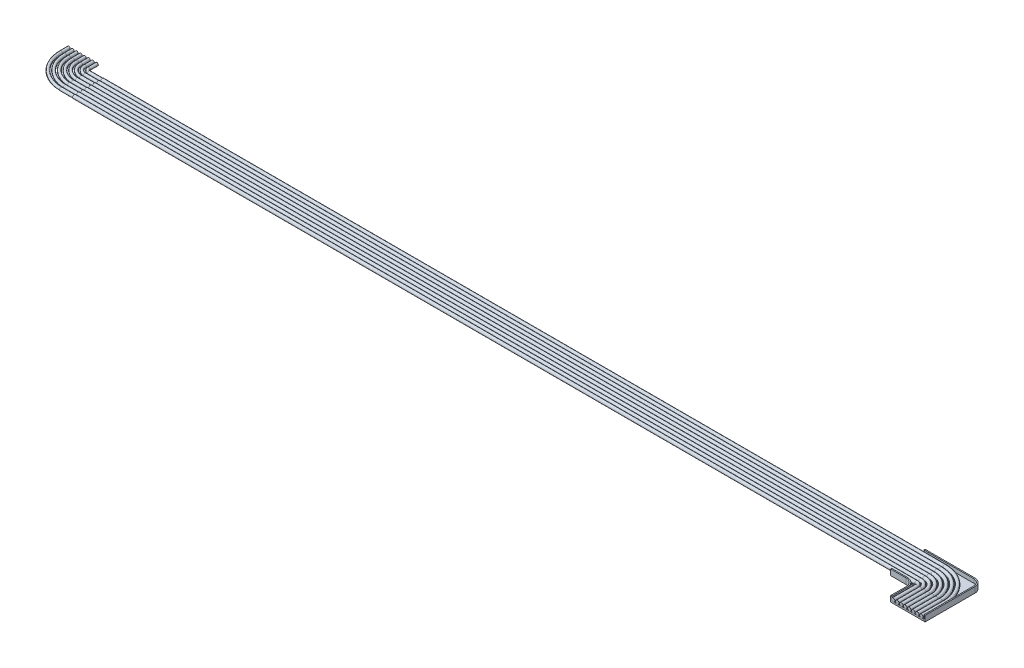
from build123d import *

# Parameters (mm, degrees)
SALIENTE_EXTRUIR1_DEPTH   = 100
CORTAR_EXTRUIR1_DEPTH     = 70
CROQUIS3_W                = 60.540405411
CROQUIS3_H                = 560
CORTAR_EXTRUIR2_DEPTH     = 70
MATRIZL1_COUNT            = 3
MATRIZL1_PITCH            = 130
CROQUIS4_W                = 560
CROQUIS4_H                = 60
CORTAR_EXTRUIR3_DEPTH     = 70
MATRIZL2_COUNT            = 3
MATRIZL2_PITCH            = 140
CROQUIS7_R                = 9.728943594
CORTAR_EXTRUIR6_DEPTH     = 70
MATRIZL3_COUNT            = 13
MATRIZL3_PITCH            = 40
MATRIZL4_COPY_1_SKETCH_R  = 9.728943594
MATRIZL4_COPY_1_DEPTH     = 70
MATRIZL4_COPY_2_SKETCH_R  = 9.728943594
MATRIZL4_COPY_2_DEPTH     = 70
MATRIZL4_COPY_3_SKETCH_R  = 9.728943594
MATRIZL4_COPY_3_DEPTH     = 70
MATRIZL4_COPY_4_SKETCH_R  = 9.728943594
MATRIZL4_COPY_4_DEPTH     = 70
MATRIZL4_COPY_5_SKETCH_R  = 9.728943594
MATRIZL4_COPY_5_DEPTH     = 70
MATRIZL4_COPY_6_SKETCH_R  = 9.728943594
MATRIZL4_COPY_6_DEPTH     = 70
MATRIZL4_COPY_7_SKETCH_R  = 9.728943594
MATRIZL4_COPY_7_DEPTH     = 70
MATRIZL4_COPY_8_SKETCH_R  = 9.728943594
MATRIZL4_COPY_8_DEPTH     = 70
MATRIZL4_COPY_9_SKETCH_R  = 9.728943594
MATRIZL4_COPY_9_DEPTH     = 70
MATRIZL4_COPY_10_SKETCH_R = 9.728943594
MATRIZL4_COPY_10_DEPTH    = 70
MATRIZL4_COPY_11_SKETCH_R = 9.728943594
MATRIZL4_COPY_11_DEPTH    = 70
MATRIZL4_COPY_12_SKETCH_R = 9.728943594
MATRIZL4_COPY_12_DEPTH    = 70
MATRIZL4_COPY_13_SKETCH_R = 9.728943594
MATRIZL4_COPY_13_DEPTH    = 70
MATRIZL4_COPY_14_SKETCH_R = 9.728943594
MATRIZL4_COPY_14_DEPTH    = 70
MATRIZL4_COPY_15_SKETCH_R = 9.728943594
MATRIZL4_COPY_15_DEPTH    = 70
MATRIZL4_COPY_16_SKETCH_R = 9.728943594
MATRIZL4_COPY_16_DEPTH    = 70
MATRIZL4_COPY_17_SKETCH_R = 9.728943594
MATRIZL4_COPY_17_DEPTH    = 70
MATRIZL4_COPY_18_SKETCH_R = 9.728943594
MATRIZL4_COPY_18_DEPTH    = 70
MATRIZL4_COPY_19_SKETCH_R = 9.728943594
MATRIZL4_COPY_19_DEPTH    = 70
MATRIZL4_COPY_20_SKETCH_R = 9.728943594
MATRIZL4_COPY_20_DEPTH    = 70
MATRIZL4_COPY_21_SKETCH_R = 9.728943594
MATRIZL4_COPY_21_DEPTH    = 70
MATRIZL4_COPY_22_SKETCH_R = 9.728943594
MATRIZL4_COPY_22_DEPTH    = 70
MATRIZL4_COPY_23_SKETCH_R = 9.728943594
MATRIZL4_COPY_23_DEPTH    = 70
MATRIZL4_COPY_24_SKETCH_R = 9.728943594
MATRIZL4_COPY_24_DEPTH    = 70
MATRIZL4_COPY_25_SKETCH_R = 9.728943594
MATRIZL4_COPY_25_DEPTH    = 70
MATRIZL4_COPY_26_SKETCH_R = 9.728943594
MATRIZL4_COPY_26_DEPTH    = 70
CROQUIS8_R                = 10.865293649
CORTAR_EXTRUIR7_DEPTH     = 70
MATRIZL5_COUNT            = 16
MATRIZL5_PITCH            = 30
MATRIZL6_COPY_1_SKETCH_R  = 10.865293649
MATRIZL6_COPY_1_DEPTH     = 70
MATRIZL6_COPY_2_SKETCH_R  = 10.865293649
MATRIZL6_COPY_2_DEPTH     = 70
MATRIZL6_COPY_3_SKETCH_R  = 10.865293649
MATRIZL6_COPY_3_DEPTH     = 70
MATRIZL6_COPY_4_SKETCH_R  = 10.865293649
MATRIZL6_COPY_4_DEPTH     = 70
MATRIZL6_COPY_5_SKETCH_R  = 10.865293649
MATRIZL6_COPY_5_DEPTH     = 70
MATRIZL6_COPY_6_SKETCH_R  = 10.865293649
MATRIZL6_COPY_6_DEPTH     = 70
MATRIZL6_COPY_7_SKETCH_R  = 10.865293649
MATRIZL6_COPY_7_DEPTH     = 70
MATRIZL6_COPY_8_SKETCH_R  = 10.865293649
MATRIZL6_COPY_8_DEPTH     = 70
MATRIZL6_COPY_9_SKETCH_R  = 10.865293649
MATRIZL6_COPY_9_DEPTH     = 70
MATRIZL6_COPY_10_SKETCH_R = 10.865293649
MATRIZL6_COPY_10_DEPTH    = 70
MATRIZL6_COPY_11_SKETCH_R = 10.865293649
MATRIZL6_COPY_11_DEPTH    = 70
MATRIZL6_COPY_12_SKETCH_R = 10.865293649
MATRIZL6_COPY_12_DEPTH    = 70
MATRIZL6_COPY_13_SKETCH_R = 10.865293649
MATRIZL6_COPY_13_DEPTH    = 70
MATRIZL6_COPY_14_SKETCH_R = 10.865293649
MATRIZL6_COPY_14_DEPTH    = 70
MATRIZL6_COPY_15_SKETCH_R = 10.865293649
MATRIZL6_COPY_15_DEPTH    = 70
MATRIZL6_COPY_16_SKETCH_R = 10.865293649
MATRIZL6_COPY_16_DEPTH    = 70
MATRIZL6_COPY_17_SKETCH_R = 10.865293649
MATRIZL6_COPY_17_DEPTH    = 70
MATRIZL6_COPY_18_SKETCH_R = 10.865293649
MATRIZL6_COPY_18_DEPTH    = 70
MATRIZL6_COPY_19_SKETCH_R = 10.865293649
MATRIZL6_COPY_19_DEPTH    = 70
MATRIZL6_COPY_20_SKETCH_R = 10.865293649
MATRIZL6_COPY_20_DEPTH    = 70
MATRIZL6_COPY_21_SKETCH_R = 10.865293649
MATRIZL6_COPY_21_DEPTH    = 70
MATRIZL6_COPY_22_SKETCH_R = 10.865293649
MATRIZL6_COPY_22_DEPTH    = 70
MATRIZL6_COPY_23_SKETCH_R = 10.865293649
MATRIZL6_COPY_23_DEPTH    = 70
MATRIZL6_COPY_24_SKETCH_R = 10.865293649
MATRIZL6_COPY_24_DEPTH    = 70
MATRIZL6_COPY_25_SKETCH_R = 10.865293649
MATRIZL6_COPY_25_DEPTH    = 70
MATRIZL6_COPY_26_SKETCH_R = 10.865293649
MATRIZL6_COPY_26_DEPTH    = 70
MATRIZL6_COPY_27_SKETCH_R = 10.865293649
MATRIZL6_COPY_27_DEPTH    = 70
MATRIZL6_COPY_28_SKETCH_R = 10.865293649
MATRIZL6_COPY_28_DEPTH    = 70
MATRIZL6_COPY_29_SKETCH_R = 10.865293649
MATRIZL6_COPY_29_DEPTH    = 70
MATRIZL6_COPY_30_SKETCH_R = 10.865293649
MATRIZL6_COPY_30_DEPTH    = 70
MATRIZL6_COPY_31_SKETCH_R = 10.865293649
MATRIZL6_COPY_31_DEPTH    = 70
MATRIZL6_COPY_32_SKETCH_R = 10.865293649
MATRIZL6_COPY_32_DEPTH    = 70
MATRIZL6_COPY_33_SKETCH_R = 10.865293649
MATRIZL6_COPY_33_DEPTH    = 70
MATRIZL6_COPY_34_SKETCH_R = 10.865293649
MATRIZL6_COPY_34_DEPTH    = 70
MATRIZL6_COPY_35_SKETCH_R = 10.865293649
MATRIZL6_COPY_35_DEPTH    = 70
MATRIZL6_COPY_36_SKETCH_R = 10.865293649
MATRIZL6_COPY_36_DEPTH    = 70
MATRIZL6_COPY_37_SKETCH_R = 10.865293649
MATRIZL6_COPY_37_DEPTH    = 70
MATRIZL6_COPY_38_SKETCH_R = 10.865293649
MATRIZL6_COPY_38_DEPTH    = 70
MATRIZL6_COPY_39_SKETCH_R = 10.865293649
MATRIZL6_COPY_39_DEPTH    = 70
MATRIZL6_COPY_40_SKETCH_R = 10.865293649
MATRIZL6_COPY_40_DEPTH    = 70
MATRIZL6_COPY_41_SKETCH_R = 10.865293649
MATRIZL6_COPY_41_DEPTH    = 70
MATRIZL6_COPY_42_SKETCH_R = 10.865293649
MATRIZL6_COPY_42_DEPTH    = 70
MATRIZL6_COPY_43_SKETCH_R = 10.865293649
MATRIZL6_COPY_43_DEPTH    = 70
MATRIZL6_COPY_44_SKETCH_R = 10.865293649
MATRIZL6_COPY_44_DEPTH    = 70
MATRIZL6_COPY_45_SKETCH_R = 10.865293649
MATRIZL6_COPY_45_DEPTH    = 70
MATRIZL6_COPY_46_SKETCH_R = 10.865293649
MATRIZL6_COPY_46_DEPTH    = 70
MATRIZL6_COPY_47_SKETCH_R = 10.865293649
MATRIZL6_COPY_47_DEPTH    = 70
MATRIZL6_COPY_48_SKETCH_R = 10.865293649
MATRIZL6_COPY_48_DEPTH    = 70
CROQUIS9_W                = 560
CROQUIS9_H                = 73.445745209
CORTAR_EXTRUIR8_DEPTH     = 70
CROQUIS10_R               = 30
CROQUIS11_R               = 30
SALIENTE_EXTRUIR2_DEPTH   = 14300
CROQUIS12_R               = 25
CROQUIS14_R               = 26.306905199
SALIENTE_EXTRUIR3_DEPTH   = 232


with BuildPart() as part:
    # Croquis1 → Saliente-Extruir1 (new body)
    with BuildSketch(Plane(origin=(0, 0, 0), x_dir=(1, 0, 0), z_dir=(0, 1, 0))):
        with BuildLine():
            Line((0, 0), (0, 270))
            ThreePointArc((0, 270), (-38.076118446, 361.923881554), (-130, 400))
            Line((-130, 400), (-400, 400))
            Line((-400, 400), (-400, 1000))
            Line((-400, 1000), (470, 1000))
            ThreePointArc((470, 1000), (561.923881554, 961.923881554), (600, 870))
            Line((600, 870), (600, 0))
            Line((600, 0), (0, 0))
        make_face()
    extrude(amount=SALIENTE_EXTRUIR1_DEPTH)

    # Croquis2 → Cortar-Extruir1 (cut)
    with BuildSketch(Plane(origin=(0, 100, 0), x_dir=(1, 0, 0), z_dir=(0, 1, 0))):
        with BuildLine():
            Line((20, 0), (580, 0))
            Line((580, 0), (580, 870))
            ThreePointArc((580, 870), (547.781745931, 947.781745931), (470, 980))
            Line((470, 980), (-400, 980))
            Line((-400, 980), (-400, 420))
            Line((-400, 420), (-130, 420))
            ThreePointArc((-130, 420), (-23.933982822, 376.066017178), (20, 270))
            Line((20, 270), (20, 0))
        make_face()
    extrude(amount=-CORTAR_EXTRUIR1_DEPTH, mode=Mode.SUBTRACT)

    # Croquis3 → Cortar-Extruir2 (cut)
    with BuildSketch(Plane(origin=(0, 30, 0), x_dir=(1, 0, 0), z_dir=(0, 1, 0))):
        with Locations((-295.270202705, 700)):
            Rectangle(CROQUIS3_W, CROQUIS3_H)
    cortar_extruir2 = extrude(amount=-CORTAR_EXTRUIR2_DEPTH, mode=Mode.SUBTRACT)

    # MatrizL1: Cortar-Extruir2 ×3
    with Locations(*[(i * MATRIZL1_PITCH, 0, 0) for i in range(1, MATRIZL1_COUNT)]):
        add(cortar_extruir2, mode=Mode.SUBTRACT)

    # Croquis4 → Cortar-Extruir3 (cut)
    with BuildSketch(Plane(origin=(0, 30, 0), x_dir=(1, 0, 0), z_dir=(0, 1, 0))):
        with Locations((300, 104)):
            Rectangle(CROQUIS4_W, CROQUIS4_H)
    cortar_extruir3 = extrude(amount=-CORTAR_EXTRUIR3_DEPTH, mode=Mode.SUBTRACT)

    # MatrizL2: Cortar-Extruir3 ×3
    with Locations(*[(0, 0, -i * MATRIZL2_PITCH) for i in range(1, MATRIZL2_COUNT)]):
        add(cortar_extruir3, mode=Mode.SUBTRACT)

    # Croquis7 → Cortar-Extruir6 (cut)
    with BuildSketch(Plane(origin=(0, 30, 0), x_dir=(1, 0, 0), z_dir=(0, 1, 0))):
        with Locations((-361.435433024, 925.957073649)):
            Circle(CROQUIS7_R)
    cortar_extruir6 = extrude(amount=-CORTAR_EXTRUIR6_DEPTH, mode=Mode.SUBTRACT)

    # MatrizL3: Cortar-Extruir6 ×13
    with Locations(*[(0, 0, i * MATRIZL3_PITCH) for i in range(1, MATRIZL3_COUNT)]):
        add(cortar_extruir6, mode=Mode.SUBTRACT)

    # MatrizL4 copy 1 sketch → MatrizL4 copy 1 (cut)
    with BuildSketch(Plane(origin=(130, 30, 40), x_dir=(1, 0, 0), z_dir=(0, 1, 0))):
        with Locations((-361.435433024, 925.957073649)):
            Circle(MATRIZL4_COPY_1_SKETCH_R)
    extrude(amount=-MATRIZL4_COPY_1_DEPTH, mode=Mode.SUBTRACT)

    # MatrizL4 copy 2 sketch → MatrizL4 copy 2 (cut)
    with BuildSketch(Plane(origin=(260, 30, 40), x_dir=(1, 0, 0), z_dir=(0, 1, 0))):
        with Locations((-361.435433024, 925.957073649)):
            Circle(MATRIZL4_COPY_2_SKETCH_R)
    extrude(amount=-MATRIZL4_COPY_2_DEPTH, mode=Mode.SUBTRACT)

    # MatrizL4 copy 3 sketch → MatrizL4 copy 3 (cut)
    with BuildSketch(Plane(origin=(130, 30, 80), x_dir=(1, 0, 0), z_dir=(0, 1, 0))):
        with Locations((-361.435433024, 925.957073649)):
            Circle(MATRIZL4_COPY_3_SKETCH_R)
    extrude(amount=-MATRIZL4_COPY_3_DEPTH, mode=Mode.SUBTRACT)

    # MatrizL4 copy 4 sketch → MatrizL4 copy 4 (cut)
    with BuildSketch(Plane(origin=(260, 30, 80), x_dir=(1, 0, 0), z_dir=(0, 1, 0))):
        with Locations((-361.435433024, 925.957073649)):
            Circle(MATRIZL4_COPY_4_SKETCH_R)
    extrude(amount=-MATRIZL4_COPY_4_DEPTH, mode=Mode.SUBTRACT)

    # MatrizL4 copy 5 sketch → MatrizL4 copy 5 (cut)
    with BuildSketch(Plane(origin=(130, 30, 120), x_dir=(1, 0, 0), z_dir=(0, 1, 0))):
        with Locations((-361.435433024, 925.957073649)):
            Circle(MATRIZL4_COPY_5_SKETCH_R)
    extrude(amount=-MATRIZL4_COPY_5_DEPTH, mode=Mode.SUBTRACT)

    # MatrizL4 copy 6 sketch → MatrizL4 copy 6 (cut)
    with BuildSketch(Plane(origin=(260, 30, 120), x_dir=(1, 0, 0), z_dir=(0, 1, 0))):
        with Locations((-361.435433024, 925.957073649)):
            Circle(MATRIZL4_COPY_6_SKETCH_R)
    extrude(amount=-MATRIZL4_COPY_6_DEPTH, mode=Mode.SUBTRACT)

    # MatrizL4 copy 7 sketch → MatrizL4 copy 7 (cut)
    with BuildSketch(Plane(origin=(130, 30, 160), x_dir=(1, 0, 0), z_dir=(0, 1, 0))):
        with Locations((-361.435433024, 925.957073649)):
            Circle(MATRIZL4_COPY_7_SKETCH_R)
    extrude(amount=-MATRIZL4_COPY_7_DEPTH, mode=Mode.SUBTRACT)

    # MatrizL4 copy 8 sketch → MatrizL4 copy 8 (cut)
    with BuildSketch(Plane(origin=(260, 30, 160), x_dir=(1, 0, 0), z_dir=(0, 1, 0))):
        with Locations((-361.435433024, 925.957073649)):
            Circle(MATRIZL4_COPY_8_SKETCH_R)
    extrude(amount=-MATRIZL4_COPY_8_DEPTH, mode=Mode.SUBTRACT)

    # MatrizL4 copy 9 sketch → MatrizL4 copy 9 (cut)
    with BuildSketch(Plane(origin=(130, 30, 200), x_dir=(1, 0, 0), z_dir=(0, 1, 0))):
        with Locations((-361.435433024, 925.957073649)):
            Circle(MATRIZL4_COPY_9_SKETCH_R)
    extrude(amount=-MATRIZL4_COPY_9_DEPTH, mode=Mode.SUBTRACT)

    # MatrizL4 copy 10 sketch → MatrizL4 copy 10 (cut)
    with BuildSketch(Plane(origin=(260, 30, 200), x_dir=(1, 0, 0), z_dir=(0, 1, 0))):
        with Locations((-361.435433024, 925.957073649)):
            Circle(MATRIZL4_COPY_10_SKETCH_R)
    extrude(amount=-MATRIZL4_COPY_10_DEPTH, mode=Mode.SUBTRACT)

    # MatrizL4 copy 11 sketch → MatrizL4 copy 11 (cut)
    with BuildSketch(Plane(origin=(130, 30, 240), x_dir=(1, 0, 0), z_dir=(0, 1, 0))):
        with Locations((-361.435433024, 925.957073649)):
            Circle(MATRIZL4_COPY_11_SKETCH_R)
    extrude(amount=-MATRIZL4_COPY_11_DEPTH, mode=Mode.SUBTRACT)

    # MatrizL4 copy 12 sketch → MatrizL4 copy 12 (cut)
    with BuildSketch(Plane(origin=(260, 30, 240), x_dir=(1, 0, 0), z_dir=(0, 1, 0))):
        with Locations((-361.435433024, 925.957073649)):
            Circle(MATRIZL4_COPY_12_SKETCH_R)
    extrude(amount=-MATRIZL4_COPY_12_DEPTH, mode=Mode.SUBTRACT)

    # MatrizL4 copy 13 sketch → MatrizL4 copy 13 (cut)
    with BuildSketch(Plane(origin=(130, 30, 280), x_dir=(1, 0, 0), z_dir=(0, 1, 0))):
        with Locations((-361.435433024, 925.957073649)):
            Circle(MATRIZL4_COPY_13_SKETCH_R)
    extrude(amount=-MATRIZL4_COPY_13_DEPTH, mode=Mode.SUBTRACT)

    # MatrizL4 copy 14 sketch → MatrizL4 copy 14 (cut)
    with BuildSketch(Plane(origin=(260, 30, 280), x_dir=(1, 0, 0), z_dir=(0, 1, 0))):
        with Locations((-361.435433024, 925.957073649)):
            Circle(MATRIZL4_COPY_14_SKETCH_R)
    extrude(amount=-MATRIZL4_COPY_14_DEPTH, mode=Mode.SUBTRACT)

    # MatrizL4 copy 15 sketch → MatrizL4 copy 15 (cut)
    with BuildSketch(Plane(origin=(130, 30, 320), x_dir=(1, 0, 0), z_dir=(0, 1, 0))):
        with Locations((-361.435433024, 925.957073649)):
            Circle(MATRIZL4_COPY_15_SKETCH_R)
    extrude(amount=-MATRIZL4_COPY_15_DEPTH, mode=Mode.SUBTRACT)

    # MatrizL4 copy 16 sketch → MatrizL4 copy 16 (cut)
    with BuildSketch(Plane(origin=(260, 30, 320), x_dir=(1, 0, 0), z_dir=(0, 1, 0))):
        with Locations((-361.435433024, 925.957073649)):
            Circle(MATRIZL4_COPY_16_SKETCH_R)
    extrude(amount=-MATRIZL4_COPY_16_DEPTH, mode=Mode.SUBTRACT)

    # MatrizL4 copy 17 sketch → MatrizL4 copy 17 (cut)
    with BuildSketch(Plane(origin=(130, 30, 360), x_dir=(1, 0, 0), z_dir=(0, 1, 0))):
        with Locations((-361.435433024, 925.957073649)):
            Circle(MATRIZL4_COPY_17_SKETCH_R)
    extrude(amount=-MATRIZL4_COPY_17_DEPTH, mode=Mode.SUBTRACT)

    # MatrizL4 copy 18 sketch → MatrizL4 copy 18 (cut)
    with BuildSketch(Plane(origin=(260, 30, 360), x_dir=(1, 0, 0), z_dir=(0, 1, 0))):
        with Locations((-361.435433024, 925.957073649)):
            Circle(MATRIZL4_COPY_18_SKETCH_R)
    extrude(amount=-MATRIZL4_COPY_18_DEPTH, mode=Mode.SUBTRACT)

    # MatrizL4 copy 19 sketch → MatrizL4 copy 19 (cut)
    with BuildSketch(Plane(origin=(130, 30, 400), x_dir=(1, 0, 0), z_dir=(0, 1, 0))):
        with Locations((-361.435433024, 925.957073649)):
            Circle(MATRIZL4_COPY_19_SKETCH_R)
    extrude(amount=-MATRIZL4_COPY_19_DEPTH, mode=Mode.SUBTRACT)

    # MatrizL4 copy 20 sketch → MatrizL4 copy 20 (cut)
    with BuildSketch(Plane(origin=(260, 30, 400), x_dir=(1, 0, 0), z_dir=(0, 1, 0))):
        with Locations((-361.435433024, 925.957073649)):
            Circle(MATRIZL4_COPY_20_SKETCH_R)
    extrude(amount=-MATRIZL4_COPY_20_DEPTH, mode=Mode.SUBTRACT)

    # MatrizL4 copy 21 sketch → MatrizL4 copy 21 (cut)
    with BuildSketch(Plane(origin=(130, 30, 440), x_dir=(1, 0, 0), z_dir=(0, 1, 0))):
        with Locations((-361.435433024, 925.957073649)):
            Circle(MATRIZL4_COPY_21_SKETCH_R)
    extrude(amount=-MATRIZL4_COPY_21_DEPTH, mode=Mode.SUBTRACT)

    # MatrizL4 copy 22 sketch → MatrizL4 copy 22 (cut)
    with BuildSketch(Plane(origin=(260, 30, 440), x_dir=(1, 0, 0), z_dir=(0, 1, 0))):
        with Locations((-361.435433024, 925.957073649)):
            Circle(MATRIZL4_COPY_22_SKETCH_R)
    extrude(amount=-MATRIZL4_COPY_22_DEPTH, mode=Mode.SUBTRACT)

    # MatrizL4 copy 23 sketch → MatrizL4 copy 23 (cut)
    with BuildSketch(Plane(origin=(130, 30, 480), x_dir=(1, 0, 0), z_dir=(0, 1, 0))):
        with Locations((-361.435433024, 925.957073649)):
            Circle(MATRIZL4_COPY_23_SKETCH_R)
    extrude(amount=-MATRIZL4_COPY_23_DEPTH, mode=Mode.SUBTRACT)

    # MatrizL4 copy 24 sketch → MatrizL4 copy 24 (cut)
    with BuildSketch(Plane(origin=(260, 30, 480), x_dir=(1, 0, 0), z_dir=(0, 1, 0))):
        with Locations((-361.435433024, 925.957073649)):
            Circle(MATRIZL4_COPY_24_SKETCH_R)
    extrude(amount=-MATRIZL4_COPY_24_DEPTH, mode=Mode.SUBTRACT)

    # MatrizL4 copy 25 sketch → MatrizL4 copy 25 (cut)
    with BuildSketch(Plane(origin=(130, 30, 0), x_dir=(1, 0, 0), z_dir=(0, 1, 0))):
        with Locations((-361.435433024, 925.957073649)):
            Circle(MATRIZL4_COPY_25_SKETCH_R)
    extrude(amount=-MATRIZL4_COPY_25_DEPTH, mode=Mode.SUBTRACT)

    # MatrizL4 copy 26 sketch → MatrizL4 copy 26 (cut)
    with BuildSketch(Plane(origin=(260, 30, 0), x_dir=(1, 0, 0), z_dir=(0, 1, 0))):
        with Locations((-361.435433024, 925.957073649)):
            Circle(MATRIZL4_COPY_26_SKETCH_R)
    extrude(amount=-MATRIZL4_COPY_26_DEPTH, mode=Mode.SUBTRACT)

    # Croquis8 → Cortar-Extruir7 (cut)
    with BuildSketch(Plane(origin=(0, 30, 0), x_dir=(1, 0, 0), z_dir=(0, 1, 0))):
        with Locations((532.716085764, 37)):
            Circle(CROQUIS8_R)
    cortar_extruir7 = extrude(amount=-CORTAR_EXTRUIR7_DEPTH, mode=Mode.SUBTRACT)

    # MatrizL5: Cortar-Extruir7 ×16
    with Locations(*[(-i * MATRIZL5_PITCH, 0, 0) for i in range(1, MATRIZL5_COUNT)]):
        add(cortar_extruir7, mode=Mode.SUBTRACT)

    # MatrizL6 copy 1 sketch → MatrizL6 copy 1 (cut)
    with BuildSketch(Plane(origin=(-30, 30, -140), x_dir=(1, 0, 0), z_dir=(0, 1, 0))):
        with Locations((532.716085764, 37)):
            Circle(MATRIZL6_COPY_1_SKETCH_R)
    extrude(amount=-MATRIZL6_COPY_1_DEPTH, mode=Mode.SUBTRACT)

    # MatrizL6 copy 2 sketch → MatrizL6 copy 2 (cut)
    with BuildSketch(Plane(origin=(-30, 30, -280), x_dir=(1, 0, 0), z_dir=(0, 1, 0))):
        with Locations((532.716085764, 37)):
            Circle(MATRIZL6_COPY_2_SKETCH_R)
    extrude(amount=-MATRIZL6_COPY_2_DEPTH, mode=Mode.SUBTRACT)

    # MatrizL6 copy 3 sketch → MatrizL6 copy 3 (cut)
    with BuildSketch(Plane(origin=(-30, 30, -420), x_dir=(1, 0, 0), z_dir=(0, 1, 0))):
        with Locations((532.716085764, 37)):
            Circle(MATRIZL6_COPY_3_SKETCH_R)
    extrude(amount=-MATRIZL6_COPY_3_DEPTH, mode=Mode.SUBTRACT)

    # MatrizL6 copy 4 sketch → MatrizL6 copy 4 (cut)
    with BuildSketch(Plane(origin=(-60, 30, -140), x_dir=(1, 0, 0), z_dir=(0, 1, 0))):
        with Locations((532.716085764, 37)):
            Circle(MATRIZL6_COPY_4_SKETCH_R)
    extrude(amount=-MATRIZL6_COPY_4_DEPTH, mode=Mode.SUBTRACT)

    # MatrizL6 copy 5 sketch → MatrizL6 copy 5 (cut)
    with BuildSketch(Plane(origin=(-60, 30, -280), x_dir=(1, 0, 0), z_dir=(0, 1, 0))):
        with Locations((532.716085764, 37)):
            Circle(MATRIZL6_COPY_5_SKETCH_R)
    extrude(amount=-MATRIZL6_COPY_5_DEPTH, mode=Mode.SUBTRACT)

    # MatrizL6 copy 6 sketch → MatrizL6 copy 6 (cut)
    with BuildSketch(Plane(origin=(-60, 30, -420), x_dir=(1, 0, 0), z_dir=(0, 1, 0))):
        with Locations((532.716085764, 37)):
            Circle(MATRIZL6_COPY_6_SKETCH_R)
    extrude(amount=-MATRIZL6_COPY_6_DEPTH, mode=Mode.SUBTRACT)

    # MatrizL6 copy 7 sketch → MatrizL6 copy 7 (cut)
    with BuildSketch(Plane(origin=(-90, 30, -140), x_dir=(1, 0, 0), z_dir=(0, 1, 0))):
        with Locations((532.716085764, 37)):
            Circle(MATRIZL6_COPY_7_SKETCH_R)
    extrude(amount=-MATRIZL6_COPY_7_DEPTH, mode=Mode.SUBTRACT)

    # MatrizL6 copy 8 sketch → MatrizL6 copy 8 (cut)
    with BuildSketch(Plane(origin=(-90, 30, -280), x_dir=(1, 0, 0), z_dir=(0, 1, 0))):
        with Locations((532.716085764, 37)):
            Circle(MATRIZL6_COPY_8_SKETCH_R)
    extrude(amount=-MATRIZL6_COPY_8_DEPTH, mode=Mode.SUBTRACT)

    # MatrizL6 copy 9 sketch → MatrizL6 copy 9 (cut)
    with BuildSketch(Plane(origin=(-90, 30, -420), x_dir=(1, 0, 0), z_dir=(0, 1, 0))):
        with Locations((532.716085764, 37)):
            Circle(MATRIZL6_COPY_9_SKETCH_R)
    extrude(amount=-MATRIZL6_COPY_9_DEPTH, mode=Mode.SUBTRACT)

    # MatrizL6 copy 10 sketch → MatrizL6 copy 10 (cut)
    with BuildSketch(Plane(origin=(-120, 30, -140), x_dir=(1, 0, 0), z_dir=(0, 1, 0))):
        with Locations((532.716085764, 37)):
            Circle(MATRIZL6_COPY_10_SKETCH_R)
    extrude(amount=-MATRIZL6_COPY_10_DEPTH, mode=Mode.SUBTRACT)

    # MatrizL6 copy 11 sketch → MatrizL6 copy 11 (cut)
    with BuildSketch(Plane(origin=(-120, 30, -280), x_dir=(1, 0, 0), z_dir=(0, 1, 0))):
        with Locations((532.716085764, 37)):
            Circle(MATRIZL6_COPY_11_SKETCH_R)
    extrude(amount=-MATRIZL6_COPY_11_DEPTH, mode=Mode.SUBTRACT)

    # MatrizL6 copy 12 sketch → MatrizL6 copy 12 (cut)
    with BuildSketch(Plane(origin=(-120, 30, -420), x_dir=(1, 0, 0), z_dir=(0, 1, 0))):
        with Locations((532.716085764, 37)):
            Circle(MATRIZL6_COPY_12_SKETCH_R)
    extrude(amount=-MATRIZL6_COPY_12_DEPTH, mode=Mode.SUBTRACT)

    # MatrizL6 copy 13 sketch → MatrizL6 copy 13 (cut)
    with BuildSketch(Plane(origin=(-150, 30, -140), x_dir=(1, 0, 0), z_dir=(0, 1, 0))):
        with Locations((532.716085764, 37)):
            Circle(MATRIZL6_COPY_13_SKETCH_R)
    extrude(amount=-MATRIZL6_COPY_13_DEPTH, mode=Mode.SUBTRACT)

    # MatrizL6 copy 14 sketch → MatrizL6 copy 14 (cut)
    with BuildSketch(Plane(origin=(-150, 30, -280), x_dir=(1, 0, 0), z_dir=(0, 1, 0))):
        with Locations((532.716085764, 37)):
            Circle(MATRIZL6_COPY_14_SKETCH_R)
    extrude(amount=-MATRIZL6_COPY_14_DEPTH, mode=Mode.SUBTRACT)

    # MatrizL6 copy 15 sketch → MatrizL6 copy 15 (cut)
    with BuildSketch(Plane(origin=(-150, 30, -420), x_dir=(1, 0, 0), z_dir=(0, 1, 0))):
        with Locations((532.716085764, 37)):
            Circle(MATRIZL6_COPY_15_SKETCH_R)
    extrude(amount=-MATRIZL6_COPY_15_DEPTH, mode=Mode.SUBTRACT)

    # MatrizL6 copy 16 sketch → MatrizL6 copy 16 (cut)
    with BuildSketch(Plane(origin=(-180, 30, -140), x_dir=(1, 0, 0), z_dir=(0, 1, 0))):
        with Locations((532.716085764, 37)):
            Circle(MATRIZL6_COPY_16_SKETCH_R)
    extrude(amount=-MATRIZL6_COPY_16_DEPTH, mode=Mode.SUBTRACT)

    # MatrizL6 copy 17 sketch → MatrizL6 copy 17 (cut)
    with BuildSketch(Plane(origin=(-180, 30, -280), x_dir=(1, 0, 0), z_dir=(0, 1, 0))):
        with Locations((532.716085764, 37)):
            Circle(MATRIZL6_COPY_17_SKETCH_R)
    extrude(amount=-MATRIZL6_COPY_17_DEPTH, mode=Mode.SUBTRACT)

    # MatrizL6 copy 18 sketch → MatrizL6 copy 18 (cut)
    with BuildSketch(Plane(origin=(-180, 30, -420), x_dir=(1, 0, 0), z_dir=(0, 1, 0))):
        with Locations((532.716085764, 37)):
            Circle(MATRIZL6_COPY_18_SKETCH_R)
    extrude(amount=-MATRIZL6_COPY_18_DEPTH, mode=Mode.SUBTRACT)

    # MatrizL6 copy 19 sketch → MatrizL6 copy 19 (cut)
    with BuildSketch(Plane(origin=(-210, 30, -140), x_dir=(1, 0, 0), z_dir=(0, 1, 0))):
        with Locations((532.716085764, 37)):
            Circle(MATRIZL6_COPY_19_SKETCH_R)
    extrude(amount=-MATRIZL6_COPY_19_DEPTH, mode=Mode.SUBTRACT)

    # MatrizL6 copy 20 sketch → MatrizL6 copy 20 (cut)
    with BuildSketch(Plane(origin=(-210, 30, -280), x_dir=(1, 0, 0), z_dir=(0, 1, 0))):
        with Locations((532.716085764, 37)):
            Circle(MATRIZL6_COPY_20_SKETCH_R)
    extrude(amount=-MATRIZL6_COPY_20_DEPTH, mode=Mode.SUBTRACT)

    # MatrizL6 copy 21 sketch → MatrizL6 copy 21 (cut)
    with BuildSketch(Plane(origin=(-210, 30, -420), x_dir=(1, 0, 0), z_dir=(0, 1, 0))):
        with Locations((532.716085764, 37)):
            Circle(MATRIZL6_COPY_21_SKETCH_R)
    extrude(amount=-MATRIZL6_COPY_21_DEPTH, mode=Mode.SUBTRACT)

    # MatrizL6 copy 22 sketch → MatrizL6 copy 22 (cut)
    with BuildSketch(Plane(origin=(-240, 30, -140), x_dir=(1, 0, 0), z_dir=(0, 1, 0))):
        with Locations((532.716085764, 37)):
            Circle(MATRIZL6_COPY_22_SKETCH_R)
    extrude(amount=-MATRIZL6_COPY_22_DEPTH, mode=Mode.SUBTRACT)

    # MatrizL6 copy 23 sketch → MatrizL6 copy 23 (cut)
    with BuildSketch(Plane(origin=(-240, 30, -280), x_dir=(1, 0, 0), z_dir=(0, 1, 0))):
        with Locations((532.716085764, 37)):
            Circle(MATRIZL6_COPY_23_SKETCH_R)
    extrude(amount=-MATRIZL6_COPY_23_DEPTH, mode=Mode.SUBTRACT)

    # MatrizL6 copy 24 sketch → MatrizL6 copy 24 (cut)
    with BuildSketch(Plane(origin=(-240, 30, -420), x_dir=(1, 0, 0), z_dir=(0, 1, 0))):
        with Locations((532.716085764, 37)):
            Circle(MATRIZL6_COPY_24_SKETCH_R)
    extrude(amount=-MATRIZL6_COPY_24_DEPTH, mode=Mode.SUBTRACT)

    # MatrizL6 copy 25 sketch → MatrizL6 copy 25 (cut)
    with BuildSketch(Plane(origin=(-270, 30, -140), x_dir=(1, 0, 0), z_dir=(0, 1, 0))):
        with Locations((532.716085764, 37)):
            Circle(MATRIZL6_COPY_25_SKETCH_R)
    extrude(amount=-MATRIZL6_COPY_25_DEPTH, mode=Mode.SUBTRACT)

    # MatrizL6 copy 26 sketch → MatrizL6 copy 26 (cut)
    with BuildSketch(Plane(origin=(-270, 30, -280), x_dir=(1, 0, 0), z_dir=(0, 1, 0))):
        with Locations((532.716085764, 37)):
            Circle(MATRIZL6_COPY_26_SKETCH_R)
    extrude(amount=-MATRIZL6_COPY_26_DEPTH, mode=Mode.SUBTRACT)

    # MatrizL6 copy 27 sketch → MatrizL6 copy 27 (cut)
    with BuildSketch(Plane(origin=(-270, 30, -420), x_dir=(1, 0, 0), z_dir=(0, 1, 0))):
        with Locations((532.716085764, 37)):
            Circle(MATRIZL6_COPY_27_SKETCH_R)
    extrude(amount=-MATRIZL6_COPY_27_DEPTH, mode=Mode.SUBTRACT)

    # MatrizL6 copy 28 sketch → MatrizL6 copy 28 (cut)
    with BuildSketch(Plane(origin=(-300, 30, -140), x_dir=(1, 0, 0), z_dir=(0, 1, 0))):
        with Locations((532.716085764, 37)):
            Circle(MATRIZL6_COPY_28_SKETCH_R)
    extrude(amount=-MATRIZL6_COPY_28_DEPTH, mode=Mode.SUBTRACT)

    # MatrizL6 copy 29 sketch → MatrizL6 copy 29 (cut)
    with BuildSketch(Plane(origin=(-300, 30, -280), x_dir=(1, 0, 0), z_dir=(0, 1, 0))):
        with Locations((532.716085764, 37)):
            Circle(MATRIZL6_COPY_29_SKETCH_R)
    extrude(amount=-MATRIZL6_COPY_29_DEPTH, mode=Mode.SUBTRACT)

    # MatrizL6 copy 30 sketch → MatrizL6 copy 30 (cut)
    with BuildSketch(Plane(origin=(-300, 30, -420), x_dir=(1, 0, 0), z_dir=(0, 1, 0))):
        with Locations((532.716085764, 37)):
            Circle(MATRIZL6_COPY_30_SKETCH_R)
    extrude(amount=-MATRIZL6_COPY_30_DEPTH, mode=Mode.SUBTRACT)

    # MatrizL6 copy 31 sketch → MatrizL6 copy 31 (cut)
    with BuildSketch(Plane(origin=(-330, 30, -140), x_dir=(1, 0, 0), z_dir=(0, 1, 0))):
        with Locations((532.716085764, 37)):
            Circle(MATRIZL6_COPY_31_SKETCH_R)
    extrude(amount=-MATRIZL6_COPY_31_DEPTH, mode=Mode.SUBTRACT)

    # MatrizL6 copy 32 sketch → MatrizL6 copy 32 (cut)
    with BuildSketch(Plane(origin=(-330, 30, -280), x_dir=(1, 0, 0), z_dir=(0, 1, 0))):
        with Locations((532.716085764, 37)):
            Circle(MATRIZL6_COPY_32_SKETCH_R)
    extrude(amount=-MATRIZL6_COPY_32_DEPTH, mode=Mode.SUBTRACT)

    # MatrizL6 copy 33 sketch → MatrizL6 copy 33 (cut)
    with BuildSketch(Plane(origin=(-330, 30, -420), x_dir=(1, 0, 0), z_dir=(0, 1, 0))):
        with Locations((532.716085764, 37)):
            Circle(MATRIZL6_COPY_33_SKETCH_R)
    extrude(amount=-MATRIZL6_COPY_33_DEPTH, mode=Mode.SUBTRACT)

    # MatrizL6 copy 34 sketch → MatrizL6 copy 34 (cut)
    with BuildSketch(Plane(origin=(-360, 30, -140), x_dir=(1, 0, 0), z_dir=(0, 1, 0))):
        with Locations((532.716085764, 37)):
            Circle(MATRIZL6_COPY_34_SKETCH_R)
    extrude(amount=-MATRIZL6_COPY_34_DEPTH, mode=Mode.SUBTRACT)

    # MatrizL6 copy 35 sketch → MatrizL6 copy 35 (cut)
    with BuildSketch(Plane(origin=(-360, 30, -280), x_dir=(1, 0, 0), z_dir=(0, 1, 0))):
        with Locations((532.716085764, 37)):
            Circle(MATRIZL6_COPY_35_SKETCH_R)
    extrude(amount=-MATRIZL6_COPY_35_DEPTH, mode=Mode.SUBTRACT)

    # MatrizL6 copy 36 sketch → MatrizL6 copy 36 (cut)
    with BuildSketch(Plane(origin=(-360, 30, -420), x_dir=(1, 0, 0), z_dir=(0, 1, 0))):
        with Locations((532.716085764, 37)):
            Circle(MATRIZL6_COPY_36_SKETCH_R)
    extrude(amount=-MATRIZL6_COPY_36_DEPTH, mode=Mode.SUBTRACT)

    # MatrizL6 copy 37 sketch → MatrizL6 copy 37 (cut)
    with BuildSketch(Plane(origin=(-390, 30, -140), x_dir=(1, 0, 0), z_dir=(0, 1, 0))):
        with Locations((532.716085764, 37)):
            Circle(MATRIZL6_COPY_37_SKETCH_R)
    extrude(amount=-MATRIZL6_COPY_37_DEPTH, mode=Mode.SUBTRACT)

    # MatrizL6 copy 38 sketch → MatrizL6 copy 38 (cut)
    with BuildSketch(Plane(origin=(-390, 30, -280), x_dir=(1, 0, 0), z_dir=(0, 1, 0))):
        with Locations((532.716085764, 37)):
            Circle(MATRIZL6_COPY_38_SKETCH_R)
    extrude(amount=-MATRIZL6_COPY_38_DEPTH, mode=Mode.SUBTRACT)

    # MatrizL6 copy 39 sketch → MatrizL6 copy 39 (cut)
    with BuildSketch(Plane(origin=(-390, 30, -420), x_dir=(1, 0, 0), z_dir=(0, 1, 0))):
        with Locations((532.716085764, 37)):
            Circle(MATRIZL6_COPY_39_SKETCH_R)
    extrude(amount=-MATRIZL6_COPY_39_DEPTH, mode=Mode.SUBTRACT)

    # MatrizL6 copy 40 sketch → MatrizL6 copy 40 (cut)
    with BuildSketch(Plane(origin=(-420, 30, -140), x_dir=(1, 0, 0), z_dir=(0, 1, 0))):
        with Locations((532.716085764, 37)):
            Circle(MATRIZL6_COPY_40_SKETCH_R)
    extrude(amount=-MATRIZL6_COPY_40_DEPTH, mode=Mode.SUBTRACT)

    # MatrizL6 copy 41 sketch → MatrizL6 copy 41 (cut)
    with BuildSketch(Plane(origin=(-420, 30, -280), x_dir=(1, 0, 0), z_dir=(0, 1, 0))):
        with Locations((532.716085764, 37)):
            Circle(MATRIZL6_COPY_41_SKETCH_R)
    extrude(amount=-MATRIZL6_COPY_41_DEPTH, mode=Mode.SUBTRACT)

    # MatrizL6 copy 42 sketch → MatrizL6 copy 42 (cut)
    with BuildSketch(Plane(origin=(-420, 30, -420), x_dir=(1, 0, 0), z_dir=(0, 1, 0))):
        with Locations((532.716085764, 37)):
            Circle(MATRIZL6_COPY_42_SKETCH_R)
    extrude(amount=-MATRIZL6_COPY_42_DEPTH, mode=Mode.SUBTRACT)

    # MatrizL6 copy 43 sketch → MatrizL6 copy 43 (cut)
    with BuildSketch(Plane(origin=(-450, 30, -140), x_dir=(1, 0, 0), z_dir=(0, 1, 0))):
        with Locations((532.716085764, 37)):
            Circle(MATRIZL6_COPY_43_SKETCH_R)
    extrude(amount=-MATRIZL6_COPY_43_DEPTH, mode=Mode.SUBTRACT)

    # MatrizL6 copy 44 sketch → MatrizL6 copy 44 (cut)
    with BuildSketch(Plane(origin=(-450, 30, -280), x_dir=(1, 0, 0), z_dir=(0, 1, 0))):
        with Locations((532.716085764, 37)):
            Circle(MATRIZL6_COPY_44_SKETCH_R)
    extrude(amount=-MATRIZL6_COPY_44_DEPTH, mode=Mode.SUBTRACT)

    # MatrizL6 copy 45 sketch → MatrizL6 copy 45 (cut)
    with BuildSketch(Plane(origin=(-450, 30, -420), x_dir=(1, 0, 0), z_dir=(0, 1, 0))):
        with Locations((532.716085764, 37)):
            Circle(MATRIZL6_COPY_45_SKETCH_R)
    extrude(amount=-MATRIZL6_COPY_45_DEPTH, mode=Mode.SUBTRACT)

    # MatrizL6 copy 46 sketch → MatrizL6 copy 46 (cut)
    with BuildSketch(Plane(origin=(0, 30, -140), x_dir=(1, 0, 0), z_dir=(0, 1, 0))):
        with Locations((532.716085764, 37)):
            Circle(MATRIZL6_COPY_46_SKETCH_R)
    extrude(amount=-MATRIZL6_COPY_46_DEPTH, mode=Mode.SUBTRACT)

    # MatrizL6 copy 47 sketch → MatrizL6 copy 47 (cut)
    with BuildSketch(Plane(origin=(0, 30, -280), x_dir=(1, 0, 0), z_dir=(0, 1, 0))):
        with Locations((532.716085764, 37)):
            Circle(MATRIZL6_COPY_47_SKETCH_R)
    extrude(amount=-MATRIZL6_COPY_47_DEPTH, mode=Mode.SUBTRACT)

    # MatrizL6 copy 48 sketch → MatrizL6 copy 48 (cut)
    with BuildSketch(Plane(origin=(0, 30, -420), x_dir=(1, 0, 0), z_dir=(0, 1, 0))):
        with Locations((532.716085764, 37)):
            Circle(MATRIZL6_COPY_48_SKETCH_R)
    extrude(amount=-MATRIZL6_COPY_48_DEPTH, mode=Mode.SUBTRACT)

    # Croquis9 → Cortar-Extruir8 (cut)
    with BuildSketch(Plane(origin=(0, 30, 0), x_dir=(1, 0, 0), z_dir=(0, 1, 0))):
        with Locations((300, 521.739716703)):
            Rectangle(CROQUIS9_W, CROQUIS9_H)
    extrude(amount=-CORTAR_EXTRUIR8_DEPTH, mode=Mode.SUBTRACT)


with BuildPart() as body_2:
    # Barrer1: sweep along a curve in space
    with BuildLine() as barrer1_path:
        Line((-400, 65, -943.908625837), (-6.098177239, 65, -943.908625837))
        ThreePointArc((-6.098177239, 65, -943.908625837), (382.810552413, 65, -782.81735549), (543.901822761, 65, -393.908625837))
        Line((543.901822761, 65, -393.908625837), (543.901822761, 65, 9.359127778))
    # Croquis10 → Barrer1 (sweep)
    with BuildSketch(Plane.ZY.offset(400)):
        with Locations((-943.908625837, 65)):
            Circle(CROQUIS10_R)
        with Locations((-873.908625837, 65)):
            Circle(CROQUIS10_R)
        with Locations((-803.908625837, 65)):
            Circle(CROQUIS10_R)
        with Locations((-733.908625837, 65)):
            Circle(CROQUIS10_R)
        with Locations((-663.908625837, 65)):
            Circle(CROQUIS10_R)
        with Locations((-593.908625837, 65)):
            Circle(CROQUIS10_R)
        with Locations((-523.908625837, 65)):
            Circle(CROQUIS10_R)
        with Locations((-453.908625837, 65)):
            Circle(CROQUIS10_R)
    sweep(path=barrer1_path.line)

    # Croquis11 → Saliente-Extruir2 (add)
    with BuildSketch(Plane.ZY.offset(400)):
        with Locations((-943.908625837, 65)):
            Circle(CROQUIS11_R)
        with Locations((-873.908625837, 65)):
            Circle(CROQUIS11_R)
        with Locations((-803.908625837, 65)):
            Circle(CROQUIS11_R)
        with Locations((-733.908625837, 65)):
            Circle(CROQUIS11_R)
        with Locations((-663.908625837, 65)):
            Circle(CROQUIS11_R)
        with Locations((-593.908625837, 65)):
            Circle(CROQUIS11_R)
        with Locations((-523.908625837, 65)):
            Circle(CROQUIS11_R)
        with Locations((-453.908625837, 65)):
            Circle(CROQUIS11_R)
    extrude(amount=SALIENTE_EXTRUIR2_DEPTH)

    # Barrer2: sweep along a curve in space
    with BuildLine() as barrer2_path:
        Line((-14700, 65, -453.908625837), (-14932.38, 65, -453.908625837))
        ThreePointArc((-14932.38, 65, -453.908625837), (-15321.288729653, 65, -614.999896185), (-15482.38, 65, -1003.908625837))
        Line((-15482.38, 65, -1003.908625837), (-15482.38, 65, -1139.984786864))
    # Croquis12 → Barrer2 (sweep)
    with BuildSketch(Plane.ZY.offset(14700)):
        with Locations((-453.908625837, 65)):
            Circle(CROQUIS12_R)
        with Locations((-523.908625837, 65)):
            Circle(CROQUIS12_R)
        with Locations((-593.908625837, 65)):
            Circle(CROQUIS12_R)
        with Locations((-663.908625837, 65)):
            Circle(CROQUIS12_R)
        with Locations((-733.908625837, 65)):
            Circle(CROQUIS12_R)
        with Locations((-803.908625837, 65)):
            Circle(CROQUIS12_R)
        with Locations((-873.908625837, 65)):
            Circle(CROQUIS12_R)
        with Locations((-943.908625837, 65)):
            Circle(CROQUIS12_R)
    sweep(path=barrer2_path.line)

    # Croquis14 → Saliente-Extruir3 (add)
    with BuildSketch(Plane.ZY.offset(14700)):
        with Locations((-451.744608298, 66.319533924)):
            Circle(CROQUIS14_R)
        with Locations((-521.744608298, 66.319533924)):
            Circle(CROQUIS14_R)
        with Locations((-591.744608298, 66.319533924)):
            Circle(CROQUIS14_R)
        with Locations((-661.744608298, 66.319533924)):
            Circle(CROQUIS14_R)
        with Locations((-731.744608298, 66.319533924)):
            Circle(CROQUIS14_R)
        with Locations((-801.744608298, 66.319533924)):
            Circle(CROQUIS14_R)
        with Locations((-871.744608298, 66.319533924)):
            Circle(CROQUIS14_R)
        with Locations((-941.744608298, 66.319533924)):
            Circle(CROQUIS14_R)
    extrude(amount=SALIENTE_EXTRUIR3_DEPTH)


solid = Compound([part.part, body_2.part])
